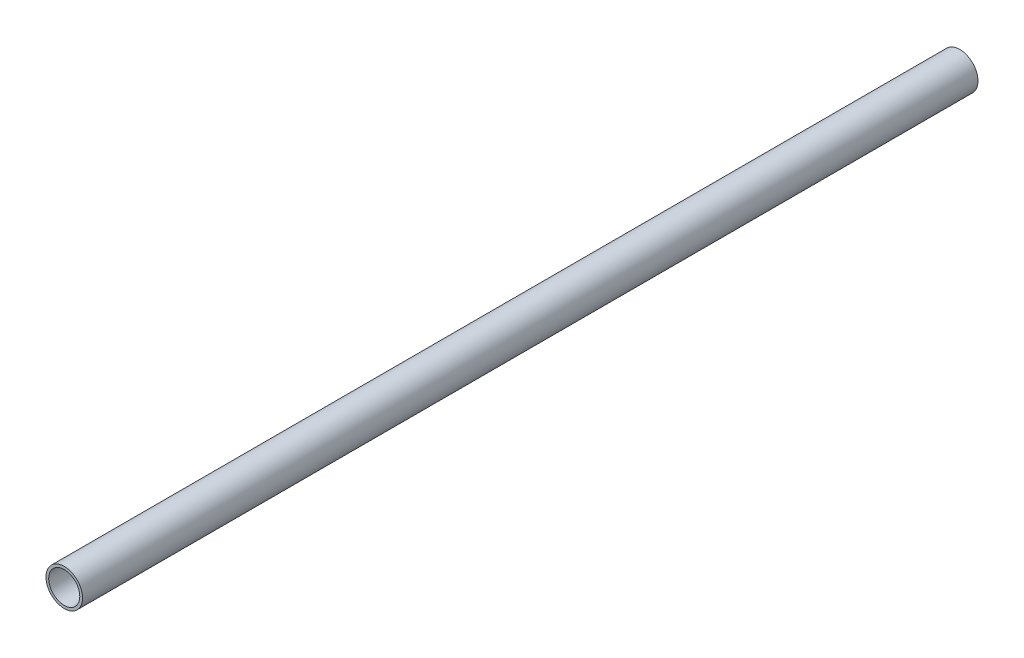
from build123d import *

# Parameters (mm, degrees)
PIPESKETCH_R    = 10
PIPESKETCH_R_2  = 8.5
EXTRUSION_DEPTH = 490


with BuildPart() as part:
    # PipeSketch → Extrusion (new body)
    with BuildSketch(Plane.XY):
        Circle(PIPESKETCH_R)
        Circle(PIPESKETCH_R_2, mode=Mode.SUBTRACT)
    extrude(amount=EXTRUSION_DEPTH)


solid = part.part
